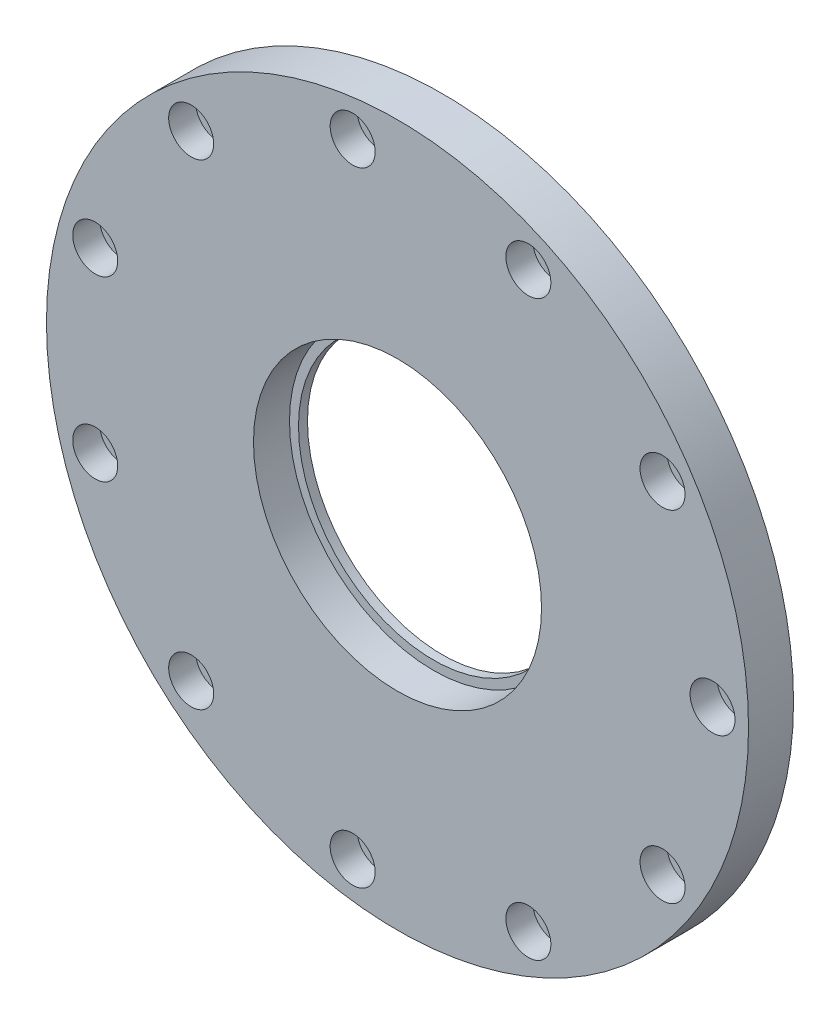
from build123d import *
from build123d.topology import SkipClean

# Parameters (mm, degrees)
SKETCH1_R           = 39
SKETCH1_R_2         = 2.5
SKETCH1_R_3         = 16
BOSS_EXTRUDE1_DEPTH = 3
BOSS_EXTRUDE2_START = 2
SKETCH2_R           = 39
SKETCH2_R_2         = 16
BOSS_EXTRUDE2_DEPTH = 2
SKETCH3_R           = 1.6
CUT_EXTRUDE1_DEPTH  = 56.380501984
SKETCH4_R           = 16
SKETCH4_R_2         = 15
BOSS_EXTRUDE3_DEPTH = 1


with BuildPart() as part:
    # Sketch1 → Boss-Extrude1 (new body)
    with BuildSketch(Plane.XY):
        Circle(SKETCH1_R)
        with Locations((35, 0)):
            Circle(SKETCH1_R_2, mode=Mode.SUBTRACT)
        with Locations((29.443873649, -18.922428611)):
            Circle(SKETCH1_R_2, mode=Mode.SUBTRACT)
        with Locations((14.539525455, -31.837119837)):
            Circle(SKETCH1_R_2, mode=Mode.SUBTRACT)
        with Locations((-4.98101934, -34.643750466)):
            Circle(SKETCH1_R_2, mode=Mode.SUBTRACT)
        with Locations((-22.920125688, -26.451235102)):
            Circle(SKETCH1_R_2, mode=Mode.SUBTRACT)
        with Locations((-33.582254077, -9.860639489)):
            Circle(SKETCH1_R_2, mode=Mode.SUBTRACT)
        with Locations((-33.582254077, 9.860639489)):
            Circle(SKETCH1_R_2, mode=Mode.SUBTRACT)
        with Locations((-22.920125688, 26.451235102)):
            Circle(SKETCH1_R_2, mode=Mode.SUBTRACT)
        with Locations((-4.98101934, 34.643750466)):
            Circle(SKETCH1_R_2, mode=Mode.SUBTRACT)
        with Locations((14.539525455, 31.837119837)):
            Circle(SKETCH1_R_2, mode=Mode.SUBTRACT)
        with Locations((29.443873649, 18.922428611)):
            Circle(SKETCH1_R_2, mode=Mode.SUBTRACT)
        Circle(SKETCH1_R_3, mode=Mode.SUBTRACT)
    extrude(amount=BOSS_EXTRUDE1_DEPTH)

    # Sketch2 → Boss-Extrude2 (add)
    with BuildSketch(Plane(origin=(0, 0, 0), x_dir=(-1, 0, 0), z_dir=(0, 0, -1)).offset(BOSS_EXTRUDE2_START)):
        Circle(SKETCH2_R)
        Circle(SKETCH2_R_2, mode=Mode.SUBTRACT)
    extrude(amount=-BOSS_EXTRUDE2_DEPTH)

    # Sketch3 → Cut-Extrude1 (cut, through all)
    with BuildSketch(Plane.XY.offset(3)):
        with Locations((35, 0)):
            Circle(SKETCH3_R)
        with Locations((29.443873649, -18.922428611)):
            Circle(SKETCH3_R)
        with Locations((14.539525455, -31.837119837)):
            Circle(SKETCH3_R)
        with Locations((-4.98101934, -34.643750466)):
            Circle(SKETCH3_R)
        with Locations((-22.920125688, -26.451235102)):
            Circle(SKETCH3_R)
        with Locations((-33.582254077, -9.860639489)):
            Circle(SKETCH3_R)
        with Locations((-33.582254077, 9.860639489)):
            Circle(SKETCH3_R)
        with Locations((-22.920125688, 26.451235102)):
            Circle(SKETCH3_R)
        with Locations((-4.98101934, 34.643750466)):
            Circle(SKETCH3_R)
        with Locations((14.539525455, 31.837119837)):
            Circle(SKETCH3_R)
        with Locations((29.443873649, 18.922428611)):
            Circle(SKETCH3_R)
    extrude(amount=-CUT_EXTRUDE1_DEPTH, mode=Mode.SUBTRACT)

    # Sketch4 → Boss-Extrude3 (add)
    with SkipClean():  # the faces are left unmerged after this step: merging them gives an invalid solid
        with BuildSketch(Plane(origin=(0, 0, -2), x_dir=(-1, 0, 0), z_dir=(0, 0, -1))):
            Circle(SKETCH4_R)
            Circle(SKETCH4_R_2, mode=Mode.SUBTRACT)
        extrude(amount=-BOSS_EXTRUDE3_DEPTH)


solid = part.part
